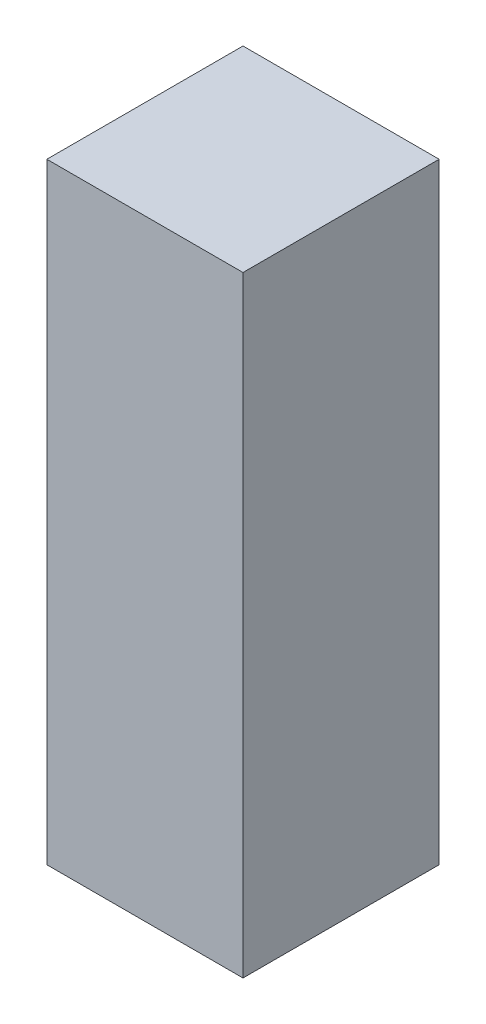
from build123d import *

# Parameters (mm, degrees)
SKETCH1_W           = 25.4
SKETCH1_H           = 25.4
BOSS_EXTRUDE1_DEPTH = 387.096
SKETCH2_W           = 25.4
SKETCH2_H           = 25.4
CUT_EXTRUDE1_DEPTH  = 307.975


with BuildPart() as part:
    # Sketch1 → Boss-Extrude1 (new body)
    with BuildSketch(Plane(origin=(0, 0, 0), x_dir=(1, 0, 0), z_dir=(0, 1, 0))):
        with Locations((12.7, 12.7)):
            Rectangle(SKETCH1_W, SKETCH1_H)
    extrude(amount=BOSS_EXTRUDE1_DEPTH)

    # Sketch2 → Cut-Extrude1 (cut)
    with BuildSketch(Plane(origin=(0, 387.096, 0), x_dir=(1, 0, 0), z_dir=(0, 1, 0))):
        with Locations((12.7, 12.7)):
            Rectangle(SKETCH2_W, SKETCH2_H)
    extrude(amount=-CUT_EXTRUDE1_DEPTH, mode=Mode.SUBTRACT)


solid = part.part
